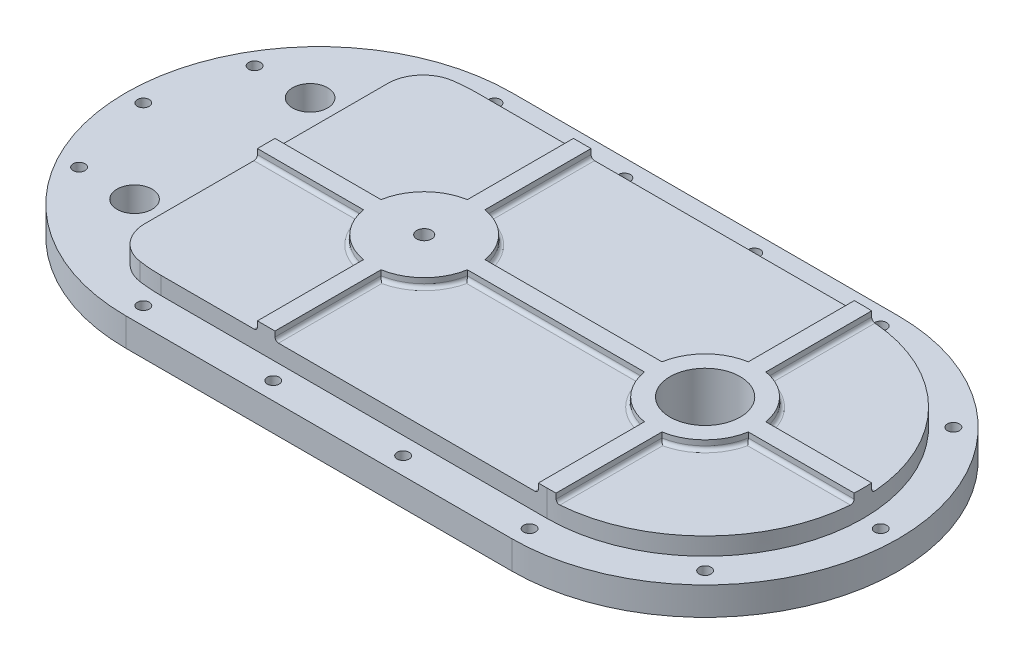
from build123d import *

# Parameters (mm, degrees)
BOSS_EXTRUDE1_DEPTH          = 16
BOSS_EXTRUDE2_DEPTH          = 10
BOSS_EXTRUDE3_DEPTH          = 5
SKETCH5_R                    = 19.999999999999986
CUT_EXTRUDE1_DEPTH           = 350.2291511314598
FILLET1_R                    = 2
TAP_DRILL_FOR_M10X1_5_TAP1_D = 8.5
TAP_DRILL_FOR_M8X1_25_TAP1_D = 6.8
SKETCH13_R                   = 10.000000000000002
CUT_EXTRUDE2_DEPTH           = 349.21832232092555


with BuildPart() as part:
    # Sketch1 → Boss-Extrude1 (new body)
    with BuildSketch(Plane(origin=(0, 0, 0), x_dir=(1, 0, 0), z_dir=(0, 1, 0))):
        with BuildLine():
            Line((0, 110.00000000000001), (220, 110.00000000000001))
            ThreePointArc((220, 110.00000000000001), (330, 0), (220, -110.00000000000001))
            Line((220, -110.00000000000001), (0, -110.00000000000001))
            ThreePointArc((0, -110.00000000000001), (-110.00000000000001, 1.347e-14), (0, 110.00000000000001))
        make_face()
    extrude(amount=BOSS_EXTRUDE1_DEPTH)

    # Sketch2 → Boss-Extrude2 (add)
    with BuildSketch(Plane(origin=(0, 16, 0), x_dir=(1, 0, 0), z_dir=(0, 1, 0))):
        with BuildLine():
            Line((-30.000000000000007, 0), (-30, -69.2820323027551))
            ThreePointArc((-29.999999999999996, -69.2820323027551), (-25.118578920369092, -82.37510571691465), (-12.857142857142861, -89.07689867497083))
            ThreePointArc((-12.857142857142863, -89.07689867497083), (-6.445119054471567, -89.76892803400119), (1.599e-14, -90))
            Line((1.653e-14, -90.00000000000001), (220, -90.00000000000001))
            ThreePointArc((220, -90), (310, -5.51e-15), (220, 90))
            Line((220, 90.00000000000001), (2.842e-14, 90.00000000000001))
            ThreePointArc((1.447e-14, 90), (-6.445119054471572, 89.76892803400119), (-12.85714285714287, 89.07689867497083))
            ThreePointArc((-12.857142857142872, 89.07689867497085), (-25.118578920369103, 82.37510571691465), (-30.000000000000018, 69.2820323027551))
            Line((-30.000000000000014, 69.2820323027551), (-30.000000000000007, 0))
        make_face()
    extrude(amount=BOSS_EXTRUDE2_DEPTH)

    # Sketch4 → Boss-Extrude3 (add)
    with BuildSketch(Plane(origin=(0, 26.000000000000004, 0), x_dir=(1, 0, 0), z_dir=(0, 1, 0))):
        with BuildLine():
            Line((-30.000000000000007, 5), (-30.000000000000007, -5))
            Line((-30.000000000000007, -5), (30.41960108450192, -5.0000000000000115))
            ThreePointArc((30.419601084501927, -5.000000000000007), (38.78679656440358, -21.213203435596427), (55.00000000000001, -29.580398915498076))
            Line((55.00000000000001, -29.58039891549808), (55, -90.00000000000001))
            Line((55, -90.00000000000001), (65, -90.00000000000001))
            Line((65, -90.00000000000001), (65, -29.58039891549808))
            ThreePointArc((64.99999999999999, -29.58039891549808), (81.2132034355964, -21.213203435596448), (89.58039891549808, -5.0000000000000195))
            Line((89.58039891549807, -5.000000000000012), (190.41960108450192, -5.000000000000006))
            ThreePointArc((190.41960108450192, -5.000000000000007), (198.78679656440357, -21.213203435596427), (215, -29.580398915498076))
            Line((215.00000000000003, -29.580398915498083), (215.00000000000003, -90))
            Line((215.00000000000003, -90.00000000000001), (220, -90.00000000000001))
            ThreePointArc((220, -90), (222.50096581092697, -89.9652442336071), (224.9999999999988, -89.86100377805721))
            Line((225.00000000000003, -89.86100377805728), (225.00000000000003, -29.580398915498073))
            ThreePointArc((225.00000000000003, -29.58039891549807), (241.21320343559643, -21.21320343559641), (249.58039891549808, -5.0000000000000195))
            Line((249.58039891549808, -5.000000000000003), (309.8610037780573, -5))
            ThreePointArc((309.86100377805724, -4.999999999998549), (310, -5.51e-15), (309.86100377805724, 4.999999999998537))
            Line((309.8610037780573, 5), (249.58039891549808, 4.999999999999999))
            ThreePointArc((249.58039891549808, 4.999999999999998), (241.21320343559643, 21.213203435596423), (225, 29.580398915498076))
            Line((225, 29.58039891549808), (225, 89.86100377805728))
            ThreePointArc((224.9999999999988, 89.86100377805721), (222.50096581092697, 89.9652442336071), (220, 90))
            Line((220, 90.00000000000001), (215, 90.00000000000001))
            Line((215, 90.00000000000001), (214.99999999999997, 29.58039891549808))
            ThreePointArc((214.99999999999997, 29.58039891549807), (198.78679656440357, 21.213203435596416), (190.41960108450192, 5.000000000000015))
            Line((190.41960108450192, 5.000000000000008), (89.58039891549807, 5.0000000000000036))
            ThreePointArc((89.58039891549808, 5.000000000000005), (81.21320343559643, 21.213203435596423), (65.00000000000001, 29.580398915498073))
            Line((65.00000000000001, 29.580398915498076), (65, 90.00000000000001))
            Line((65, 90.00000000000001), (55, 90.00000000000001))
            Line((55, 90.00000000000001), (55, 29.58039891549808))
            ThreePointArc((55, 29.580398915498076), (38.78679656440357, 21.213203435596423), (30.419601084501924, 5.000000000000002))
            Line((30.41960108450192, 5.000000000000002), (-30.000000000000007, 5))
        make_face()
    extrude(amount=BOSS_EXTRUDE3_DEPTH)

    # Sketch5 → Cut-Extrude1 (cut, through all)
    with BuildSketch(Plane(origin=(0, 31.000000000000004, 0), x_dir=(1, 0, 0), z_dir=(0, 1, 0))):
        with Locations((220, 0)):
            Circle(SKETCH5_R)
    extrude(amount=-CUT_EXTRUDE1_DEPTH, mode=Mode.SUBTRACT)

    # Fillet1
    fillet1_edges = [part.edges().sort_by_distance(p)[0] for p in [
        (55, 26.000000000000004, -59.79019945774905),
        (38.78679656440357, 26.000000000000004, -21.213203435596427),
        (0.20980054225095657, 26.000000000000004, -5.000000000000001),
        (215, 26.000000000000004, -59.79019945774905),
        (198.78679656440357, 26.000000000000004, -21.21320343559642),
        (65, 26.000000000000004, -59.79019945774904),
        (81.21320343559643, 26.000000000000004, -21.21320343559642),
        (140, 26.000000000000004, -5.000000000000005),
        (279.7207013467777, 26.000000000000004, -5),
        (225, 26.000000000000004, -59.72070134677768),
        (241.21320343559643, 26.000000000000004, -21.213203435596423),
        (279.7207013467777, 26.000000000000004, 5.000000000000002),
        (241.21320343559643, 26.000000000000004, 21.213203435596412),
        (225.00000000000003, 26.000000000000004, 59.72070134677767),
        (198.78679656440357, 26.000000000000004, 21.21320343559643),
        (215.00000000000003, 26.000000000000004, 59.79019945774904),
        (140, 26.000000000000004, 5.000000000000009),
        (81.21320343559641, 26.000000000000004, 21.213203435596434),
        (65, 26.000000000000004, 59.79019945774905),
        (55, 26.000000000000004, 59.79019945774905),
        (38.78679656440358, 26.000000000000004, 21.213203435596434),
        (0.20980054225095657, 26.000000000000004, 5.000000000000005),
    ]]
    fillet(fillet1_edges, radius=FILLET1_R)

    # Tap Drill for M10x1.5 Tap1 (through all)
    with Locations(Plane(origin=(0, 31.000000000000004, 0), x_dir=(1, 0, 0), z_dir=(0, 1, 0))):
        with Locations((60, 0)):
            Hole(TAP_DRILL_FOR_M10X1_5_TAP1_D / 2)

    # Tap Drill for M8x1.25 Tap1 (through all)
    with Locations(Plane(origin=(0, 16, 0), x_dir=(1, 0, 0), z_dir=(0, 1, 0))):
        with Locations((-100, 0), (-86.602540378, 50), (0, 100), (220, 100), (74, 100), (148, 100), (320, 0), (290.710678119, 70.710678119), (-86.602540378, -50), (0, -100), (74, -100), (148, -100), (220, -100), (290.710678119, -70.710678119)):
            Hole(TAP_DRILL_FOR_M8X1_25_TAP1_D / 2)

    # Sketch13 → Cut-Extrude2 (cut, through all)
    with BuildSketch(Plane(origin=(0, 16, 0), x_dir=(1, 0, 0), z_dir=(0, 1, 0))):
        with Locations((-54.999999999999986, 50.000000000000014)):
            Circle(SKETCH13_R)
        with Locations((-55, -49.999999999999986)):
            Circle(SKETCH13_R)
    extrude(amount=-CUT_EXTRUDE2_DEPTH, mode=Mode.SUBTRACT)


solid = part.part
